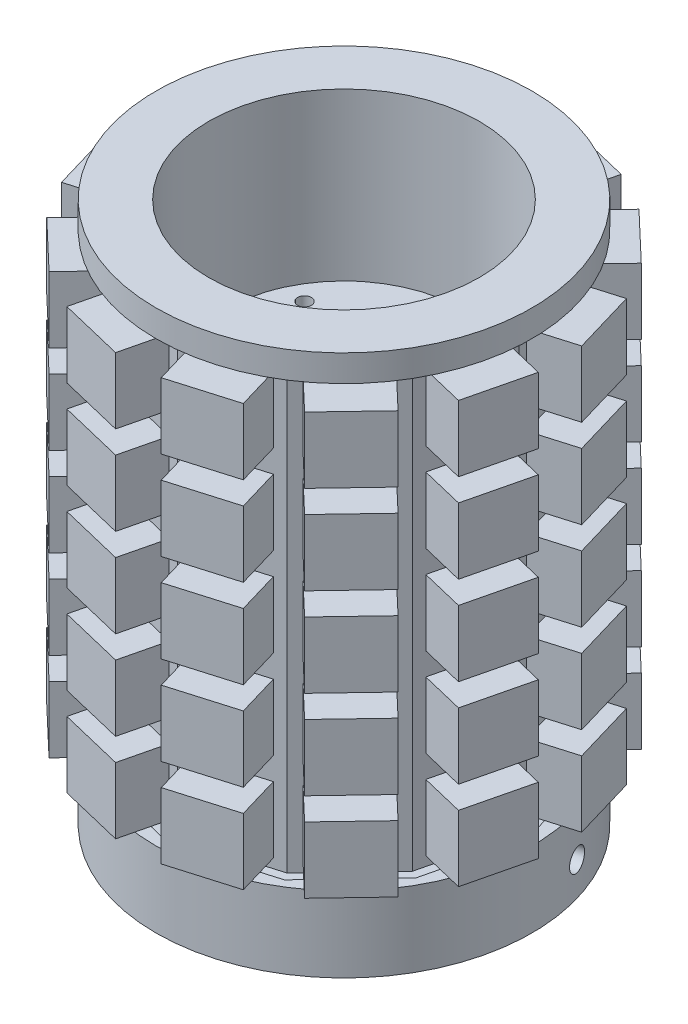
from build123d import *

# Parameters (mm, degrees)
EXTRUDE_THIN2_DEPTH        = 100
SKETCH4_W                  = 14.9
SKETCH4_H                  = 14.9
BOSS_EXTRUDE1_DEPTH        = 10
CIRPATTERN1_COUNT          = 12
LPATTERN1_COUNT            = 5
LPATTERN1_PITCH            = 20
LPATTERN1_COPY_1_SKETCH_W  = 14.9
LPATTERN1_COPY_1_SKETCH_H  = 14.9
LPATTERN1_COPY_1_DEPTH     = 10
LPATTERN1_COPY_2_SKETCH_W  = 14.9
LPATTERN1_COPY_2_SKETCH_H  = 14.9
LPATTERN1_COPY_2_DEPTH     = 10
LPATTERN1_COPY_3_SKETCH_W  = 14.9
LPATTERN1_COPY_3_SKETCH_H  = 14.9
LPATTERN1_COPY_3_DEPTH     = 10
LPATTERN1_COPY_4_SKETCH_W  = 14.9
LPATTERN1_COPY_4_SKETCH_H  = 14.9
LPATTERN1_COPY_4_DEPTH     = 10
LPATTERN1_COPY_5_SKETCH_W  = 14.9
LPATTERN1_COPY_5_SKETCH_H  = 14.9
LPATTERN1_COPY_5_DEPTH     = 10
LPATTERN1_COPY_6_SKETCH_W  = 14.9
LPATTERN1_COPY_6_SKETCH_H  = 14.9
LPATTERN1_COPY_6_DEPTH     = 10
LPATTERN1_COPY_7_SKETCH_W  = 14.9
LPATTERN1_COPY_7_SKETCH_H  = 14.9
LPATTERN1_COPY_7_DEPTH     = 10
LPATTERN1_COPY_8_SKETCH_W  = 14.9
LPATTERN1_COPY_8_SKETCH_H  = 14.9
LPATTERN1_COPY_8_DEPTH     = 10
LPATTERN1_COPY_9_SKETCH_W  = 14.9
LPATTERN1_COPY_9_SKETCH_H  = 14.9
LPATTERN1_COPY_9_DEPTH     = 10
LPATTERN1_COPY_10_SKETCH_W = 14.9
LPATTERN1_COPY_10_SKETCH_H = 14.9
LPATTERN1_COPY_10_DEPTH    = 10
LPATTERN1_COPY_11_SKETCH_W = 14.9
LPATTERN1_COPY_11_SKETCH_H = 14.9
LPATTERN1_COPY_11_DEPTH    = 10
LPATTERN1_COPY_12_SKETCH_W = 14.9
LPATTERN1_COPY_12_SKETCH_H = 14.9
LPATTERN1_COPY_12_DEPTH    = 10
LPATTERN1_COPY_13_SKETCH_W = 14.9
LPATTERN1_COPY_13_SKETCH_H = 14.9
LPATTERN1_COPY_13_DEPTH    = 10
LPATTERN1_COPY_14_SKETCH_W = 14.9
LPATTERN1_COPY_14_SKETCH_H = 14.9
LPATTERN1_COPY_14_DEPTH    = 10
LPATTERN1_COPY_15_SKETCH_W = 14.9
LPATTERN1_COPY_15_SKETCH_H = 14.9
LPATTERN1_COPY_15_DEPTH    = 10
LPATTERN1_COPY_16_SKETCH_W = 14.9
LPATTERN1_COPY_16_SKETCH_H = 14.9
LPATTERN1_COPY_16_DEPTH    = 10
LPATTERN1_COPY_17_SKETCH_W = 14.9
LPATTERN1_COPY_17_SKETCH_H = 14.9
LPATTERN1_COPY_17_DEPTH    = 10
LPATTERN1_COPY_18_SKETCH_W = 14.9
LPATTERN1_COPY_18_SKETCH_H = 14.9
LPATTERN1_COPY_18_DEPTH    = 10
LPATTERN1_COPY_19_SKETCH_W = 14.9
LPATTERN1_COPY_19_SKETCH_H = 14.9
LPATTERN1_COPY_19_DEPTH    = 10
LPATTERN1_COPY_20_SKETCH_W = 14.9
LPATTERN1_COPY_20_SKETCH_H = 14.9
LPATTERN1_COPY_20_DEPTH    = 10
LPATTERN1_COPY_21_SKETCH_W = 14.9
LPATTERN1_COPY_21_SKETCH_H = 14.9
LPATTERN1_COPY_21_DEPTH    = 10
LPATTERN1_COPY_22_SKETCH_W = 14.9
LPATTERN1_COPY_22_SKETCH_H = 14.9
LPATTERN1_COPY_22_DEPTH    = 10
LPATTERN1_COPY_23_SKETCH_W = 14.9
LPATTERN1_COPY_23_SKETCH_H = 14.9
LPATTERN1_COPY_23_DEPTH    = 10
LPATTERN1_COPY_24_SKETCH_W = 14.9
LPATTERN1_COPY_24_SKETCH_H = 14.9
LPATTERN1_COPY_24_DEPTH    = 10
LPATTERN1_COPY_25_SKETCH_W = 14.9
LPATTERN1_COPY_25_SKETCH_H = 14.9
LPATTERN1_COPY_25_DEPTH    = 10
LPATTERN1_COPY_26_SKETCH_W = 14.9
LPATTERN1_COPY_26_SKETCH_H = 14.9
LPATTERN1_COPY_26_DEPTH    = 10
LPATTERN1_COPY_27_SKETCH_W = 14.9
LPATTERN1_COPY_27_SKETCH_H = 14.9
LPATTERN1_COPY_27_DEPTH    = 10
LPATTERN1_COPY_28_SKETCH_W = 14.9
LPATTERN1_COPY_28_SKETCH_H = 14.9
LPATTERN1_COPY_28_DEPTH    = 10
LPATTERN1_COPY_29_SKETCH_W = 14.9
LPATTERN1_COPY_29_SKETCH_H = 14.9
LPATTERN1_COPY_29_DEPTH    = 10
LPATTERN1_COPY_30_SKETCH_W = 14.9
LPATTERN1_COPY_30_SKETCH_H = 14.9
LPATTERN1_COPY_30_DEPTH    = 10
LPATTERN1_COPY_31_SKETCH_W = 14.9
LPATTERN1_COPY_31_SKETCH_H = 14.9
LPATTERN1_COPY_31_DEPTH    = 10
LPATTERN1_COPY_32_SKETCH_W = 14.9
LPATTERN1_COPY_32_SKETCH_H = 14.9
LPATTERN1_COPY_32_DEPTH    = 10
LPATTERN1_COPY_33_SKETCH_W = 14.9
LPATTERN1_COPY_33_SKETCH_H = 14.9
LPATTERN1_COPY_33_DEPTH    = 10
LPATTERN1_COPY_34_SKETCH_W = 14.9
LPATTERN1_COPY_34_SKETCH_H = 14.9
LPATTERN1_COPY_34_DEPTH    = 10
LPATTERN1_COPY_35_SKETCH_W = 14.9
LPATTERN1_COPY_35_SKETCH_H = 14.9
LPATTERN1_COPY_35_DEPTH    = 10
LPATTERN1_COPY_36_SKETCH_W = 14.9
LPATTERN1_COPY_36_SKETCH_H = 14.9
LPATTERN1_COPY_36_DEPTH    = 10
LPATTERN1_COPY_37_SKETCH_W = 14.9
LPATTERN1_COPY_37_SKETCH_H = 14.9
LPATTERN1_COPY_37_DEPTH    = 10
LPATTERN1_COPY_38_SKETCH_W = 14.9
LPATTERN1_COPY_38_SKETCH_H = 14.9
LPATTERN1_COPY_38_DEPTH    = 10
LPATTERN1_COPY_39_SKETCH_W = 14.9
LPATTERN1_COPY_39_SKETCH_H = 14.9
LPATTERN1_COPY_39_DEPTH    = 10
LPATTERN1_COPY_40_SKETCH_W = 14.9
LPATTERN1_COPY_40_SKETCH_H = 14.9
LPATTERN1_COPY_40_DEPTH    = 10
LPATTERN1_COPY_41_SKETCH_W = 14.9
LPATTERN1_COPY_41_SKETCH_H = 14.9
LPATTERN1_COPY_41_DEPTH    = 10
LPATTERN1_COPY_42_SKETCH_W = 14.9
LPATTERN1_COPY_42_SKETCH_H = 14.9
LPATTERN1_COPY_42_DEPTH    = 10
LPATTERN1_COPY_43_SKETCH_W = 14.9
LPATTERN1_COPY_43_SKETCH_H = 14.9
LPATTERN1_COPY_43_DEPTH    = 10
LPATTERN1_COPY_44_SKETCH_W = 14.9
LPATTERN1_COPY_44_SKETCH_H = 14.9
LPATTERN1_COPY_44_DEPTH    = 10
SKETCH6_R                  = 42.363501302
BOSS_EXTRUDE2_DEPTH        = 12
SKETCH7_R                  = 42.363501302
BOSS_EXTRUDE3_DEPTH        = 5
SKETCH8_R                  = 2.5
CUT_EXTRUDE1_DEPTH         = 10
BOSS_EXTRUDE4_DEPTH        = 3
BOSS_EXTRUDE4_DEPTH_BACK   = 1
SKETCH10_R                 = 42.363501302
SKETCH11_R                 = 42.363501302
BOSS_EXTRUDE5_DEPTH        = 2
SKETCH12_R                 = 32.5
SKETCH12_R_2               = 30.5
BOSS_EXTRUDE6_DEPTH        = 95
SKETCH13_R                 = 30.5
CUT_EXTRUDE3_DEPTH         = 95
SKETCH14_R                 = 32.5
BOSS_EXTRUDE7_DEPTH        = 2
SKETCH9_R                  = 1.55
CUT_EXTRUDE2_DEPTH         = 138
SKETCH15_R                 = 2.85
CUT_EXTRUDE4_DEPTH         = 3.2


with BuildPart() as part:
    # Loft1: read off the stored shape, not the designer's step
    # Loft1: loft between two sections, ruled curve by curve
    loft1_from = [
        Edge.make_bspline([(17.67910354, 0, 31.359995185), (80.399093911, 0, -3.998211894), (45.040886831, 0, -66.718202265), (-17.67910354, 0, -31.359995185), (-80.399093911, 0, 3.998211894), (-45.040886831, 0, 66.718202265), (17.67910354, 0, 31.359995185)], [0, 0, 0, 0, 0.5, 0.5, 0.5, 1, 1, 1, 1], 3, [1, 0.333333333, 0.333333333, 1, 0.333333333, 0.333333333, 1]),
    ]
    loft1_to = [
        Edge.make_bspline([(22.196815987, 70, 15.3720968), (52.941009587, 70, -29.021535174), (8.547377613, 70, -59.765728774), (-22.196815987, 70, -15.3720968), (-52.941009587, 70, 29.021535174), (-8.547377613, 70, 59.765728774), (22.196815987, 70, 15.3720968)], [0, 0, 0, 0, 0.5, 0.5, 0.5, 1, 1, 1, 1], 3, [1, 0.333333333, 0.333333333, 1, 0.333333333, 0.333333333, 1]),
    ]
    loft1 = Solid(Shell([*[Face.make_surface_from_curves(loft1_from[k], loft1_to[k]) for k in range(1)], Face(Wire(loft1_from)), Face(Wire(loft1_to))]))
    add(loft1)


with BuildPart() as body_2:
    # Sketch3 → Extrude-Thin2 (new body)
    with BuildSketch(Plane(origin=(0, 0, 0), x_dir=(-1, 0, 0), z_dir=(0, -1, 0))):
        Polygon((-18.425658339, 33.818491341), (-32.866333873, 20.07484345), (-38.500501789, 0.952157468), (-33.818491341, -18.425658339), (-20.07484345, -32.866333873), (-0.952157468, -38.500501789), (18.425658339, -33.818491341), (32.866333873, -20.07484345), (38.500501789, -0.952157468), (33.818491341, 18.425658339), (20.07484345, 32.866333873), (0.952157468, 38.500501789), align=None)
        Polygon((-17.831282263, 32.727572266), (-31.806129555, 19.427267855), (-37.258550118, 0.921442711), (-32.727572266, -17.831282263), (-19.427267855, -31.806129555), (-0.921442711, -37.258550118), (17.831282263, -32.727572266), (31.806129555, -19.427267855), (37.258550118, -0.921442711), (32.727572266, 17.831282263), (19.427267855, 31.806129555), (0.921442711, 37.258550118), align=None, mode=Mode.SUBTRACT)
    extrude(amount=-EXTRUDE_THIN2_DEPTH)

    # Sketch4 → Boss-Extrude1 (add)
    with BuildSketch(Plane(origin=(-10.513500459, 0, -35.683417831), x_dir=(-0.959231662124633, 0, 0.2826209800733382), z_dir=(-0.2826209800733382, 0, -0.959231662124633))):
        with Locations((0, 89.55)):
            Rectangle(SKETCH4_W, SKETCH4_H)
    boss_extrude1 = extrude(amount=BOSS_EXTRUDE1_DEPTH)

    # CirPattern1: Boss-Extrude1 ×12 about axis
    cirpattern1_axis = Axis((0, 0, 0), (0, 1, 0))
    for i in range(1, CIRPATTERN1_COUNT):
        add(boss_extrude1.rotate(cirpattern1_axis, i * 360 / CIRPATTERN1_COUNT))

    # LPattern1: Boss-Extrude1 ×5
    with Locations(*[(0, -i * LPATTERN1_PITCH, 0) for i in range(1, LPATTERN1_COUNT)]):
        add(boss_extrude1)

    # LPattern1 copy 1 sketch → LPattern1 copy 1 (add)
    with BuildSketch(Plane(origin=(-26.946667395, -20, -25.645996106), x_dir=(-0.6894084974776344, 0, 0.7243727794482829), z_dir=(-0.7243727794482829, 0, -0.6894084974776344))):
        with Locations((0, 89.55)):
            Rectangle(LPATTERN1_COPY_1_SKETCH_W, LPATTERN1_COPY_1_SKETCH_H)
    extrude(amount=LPATTERN1_COPY_1_DEPTH)

    # LPattern1 copy 2 sketch → LPattern1 copy 2 (add)
    with BuildSketch(Plane(origin=(-26.946667395, -40, -25.645996106), x_dir=(-0.6894084974776344, 0, 0.7243727794482829), z_dir=(-0.7243727794482829, 0, -0.6894084974776344))):
        with Locations((0, 89.55)):
            Rectangle(LPATTERN1_COPY_2_SKETCH_W, LPATTERN1_COPY_2_SKETCH_H)
    extrude(amount=LPATTERN1_COPY_2_DEPTH)

    # LPattern1 copy 3 sketch → LPattern1 copy 3 (add)
    with BuildSketch(Plane(origin=(-26.946667395, -60, -25.645996106), x_dir=(-0.6894084974776344, 0, 0.7243727794482829), z_dir=(-0.7243727794482829, 0, -0.6894084974776344))):
        with Locations((0, 89.55)):
            Rectangle(LPATTERN1_COPY_3_SKETCH_W, LPATTERN1_COPY_3_SKETCH_H)
    extrude(amount=LPATTERN1_COPY_3_DEPTH)

    # LPattern1 copy 4 sketch → LPattern1 copy 4 (add)
    with BuildSketch(Plane(origin=(-26.946667395, -80, -25.645996106), x_dir=(-0.6894084974776344, 0, 0.7243727794482829), z_dir=(-0.7243727794482829, 0, -0.6894084974776344))):
        with Locations((0, 89.55)):
            Rectangle(LPATTERN1_COPY_4_SKETCH_W, LPATTERN1_COPY_4_SKETCH_H)
    extrude(amount=LPATTERN1_COPY_4_DEPTH)

    # LPattern1 copy 5 sketch → LPattern1 copy 5 (add)
    with BuildSketch(Plane(origin=(-36.159496565, -20, -8.736750436), x_dir=(-0.2348588826763501, 0, 0.9720294775509726), z_dir=(-0.9720294775509726, 0, -0.2348588826763501))):
        with Locations((0, 89.55)):
            Rectangle(LPATTERN1_COPY_5_SKETCH_W, LPATTERN1_COPY_5_SKETCH_H)
    extrude(amount=LPATTERN1_COPY_5_DEPTH)

    # LPattern1 copy 6 sketch → LPattern1 copy 6 (add)
    with BuildSketch(Plane(origin=(-36.159496565, -40, -8.736750436), x_dir=(-0.2348588826763501, 0, 0.9720294775509726), z_dir=(-0.9720294775509726, 0, -0.2348588826763501))):
        with Locations((0, 89.55)):
            Rectangle(LPATTERN1_COPY_6_SKETCH_W, LPATTERN1_COPY_6_SKETCH_H)
    extrude(amount=LPATTERN1_COPY_6_DEPTH)

    # LPattern1 copy 7 sketch → LPattern1 copy 7 (add)
    with BuildSketch(Plane(origin=(-36.159496565, -60, -8.736750436), x_dir=(-0.2348588826763501, 0, 0.9720294775509726), z_dir=(-0.9720294775509726, 0, -0.2348588826763501))):
        with Locations((0, 89.55)):
            Rectangle(LPATTERN1_COPY_7_SKETCH_W, LPATTERN1_COPY_7_SKETCH_H)
    extrude(amount=LPATTERN1_COPY_7_DEPTH)

    # LPattern1 copy 8 sketch → LPattern1 copy 8 (add)
    with BuildSketch(Plane(origin=(-36.159496565, -80, -8.736750436), x_dir=(-0.2348588826763501, 0, 0.9720294775509726), z_dir=(-0.9720294775509726, 0, -0.2348588826763501))):
        with Locations((0, 89.55)):
            Rectangle(LPATTERN1_COPY_8_SKETCH_W, LPATTERN1_COPY_8_SKETCH_H)
    extrude(amount=LPATTERN1_COPY_8_DEPTH)

    # LPattern1 copy 9 sketch → LPattern1 copy 9 (add)
    with BuildSketch(Plane(origin=(-35.683417831, -20, 10.513500459), x_dir=(0.28262098007333813, 0, 0.959231662124633), z_dir=(-0.959231662124633, 0, 0.28262098007333813))):
        with Locations((0, 89.55)):
            Rectangle(LPATTERN1_COPY_9_SKETCH_W, LPATTERN1_COPY_9_SKETCH_H)
    extrude(amount=LPATTERN1_COPY_9_DEPTH)

    # LPattern1 copy 10 sketch → LPattern1 copy 10 (add)
    with BuildSketch(Plane(origin=(-35.683417831, -40, 10.513500459), x_dir=(0.28262098007333813, 0, 0.959231662124633), z_dir=(-0.959231662124633, 0, 0.28262098007333813))):
        with Locations((0, 89.55)):
            Rectangle(LPATTERN1_COPY_10_SKETCH_W, LPATTERN1_COPY_10_SKETCH_H)
    extrude(amount=LPATTERN1_COPY_10_DEPTH)

    # LPattern1 copy 11 sketch → LPattern1 copy 11 (add)
    with BuildSketch(Plane(origin=(-35.683417831, -60, 10.513500459), x_dir=(0.28262098007333813, 0, 0.959231662124633), z_dir=(-0.959231662124633, 0, 0.28262098007333813))):
        with Locations((0, 89.55)):
            Rectangle(LPATTERN1_COPY_11_SKETCH_W, LPATTERN1_COPY_11_SKETCH_H)
    extrude(amount=LPATTERN1_COPY_11_DEPTH)

    # LPattern1 copy 12 sketch → LPattern1 copy 12 (add)
    with BuildSketch(Plane(origin=(-35.683417831, -80, 10.513500459), x_dir=(0.28262098007333813, 0, 0.959231662124633), z_dir=(-0.959231662124633, 0, 0.28262098007333813))):
        with Locations((0, 89.55)):
            Rectangle(LPATTERN1_COPY_12_SKETCH_W, LPATTERN1_COPY_12_SKETCH_H)
    extrude(amount=LPATTERN1_COPY_12_DEPTH)

    # LPattern1 copy 13 sketch → LPattern1 copy 13 (add)
    with BuildSketch(Plane(origin=(-25.645996106, -20, 26.946667395), x_dir=(0.7243727794482828, 0, 0.6894084974776344), z_dir=(-0.6894084974776344, 0, 0.7243727794482828))):
        with Locations((0, 89.55)):
            Rectangle(LPATTERN1_COPY_13_SKETCH_W, LPATTERN1_COPY_13_SKETCH_H)
    extrude(amount=LPATTERN1_COPY_13_DEPTH)

    # LPattern1 copy 14 sketch → LPattern1 copy 14 (add)
    with BuildSketch(Plane(origin=(-25.645996106, -40, 26.946667395), x_dir=(0.7243727794482828, 0, 0.6894084974776344), z_dir=(-0.6894084974776344, 0, 0.7243727794482828))):
        with Locations((0, 89.55)):
            Rectangle(LPATTERN1_COPY_14_SKETCH_W, LPATTERN1_COPY_14_SKETCH_H)
    extrude(amount=LPATTERN1_COPY_14_DEPTH)

    # LPattern1 copy 15 sketch → LPattern1 copy 15 (add)
    with BuildSketch(Plane(origin=(-25.645996106, -60, 26.946667395), x_dir=(0.7243727794482828, 0, 0.6894084974776344), z_dir=(-0.6894084974776344, 0, 0.7243727794482828))):
        with Locations((0, 89.55)):
            Rectangle(LPATTERN1_COPY_15_SKETCH_W, LPATTERN1_COPY_15_SKETCH_H)
    extrude(amount=LPATTERN1_COPY_15_DEPTH)

    # LPattern1 copy 16 sketch → LPattern1 copy 16 (add)
    with BuildSketch(Plane(origin=(-25.645996106, -80, 26.946667395), x_dir=(0.7243727794482828, 0, 0.6894084974776344), z_dir=(-0.6894084974776344, 0, 0.7243727794482828))):
        with Locations((0, 89.55)):
            Rectangle(LPATTERN1_COPY_16_SKETCH_W, LPATTERN1_COPY_16_SKETCH_H)
    extrude(amount=LPATTERN1_COPY_16_DEPTH)

    # LPattern1 copy 17 sketch → LPattern1 copy 17 (add)
    with BuildSketch(Plane(origin=(-8.736750436, -20, 36.159496565), x_dir=(0.9720294775509726, 0, 0.2348588826763499), z_dir=(-0.2348588826763499, 0, 0.9720294775509726))):
        with Locations((0, 89.55)):
            Rectangle(LPATTERN1_COPY_17_SKETCH_W, LPATTERN1_COPY_17_SKETCH_H)
    extrude(amount=LPATTERN1_COPY_17_DEPTH)

    # LPattern1 copy 18 sketch → LPattern1 copy 18 (add)
    with BuildSketch(Plane(origin=(-8.736750436, -40, 36.159496565), x_dir=(0.9720294775509726, 0, 0.2348588826763499), z_dir=(-0.2348588826763499, 0, 0.9720294775509726))):
        with Locations((0, 89.55)):
            Rectangle(LPATTERN1_COPY_18_SKETCH_W, LPATTERN1_COPY_18_SKETCH_H)
    extrude(amount=LPATTERN1_COPY_18_DEPTH)

    # LPattern1 copy 19 sketch → LPattern1 copy 19 (add)
    with BuildSketch(Plane(origin=(-8.736750436, -60, 36.159496565), x_dir=(0.9720294775509726, 0, 0.2348588826763499), z_dir=(-0.2348588826763499, 0, 0.9720294775509726))):
        with Locations((0, 89.55)):
            Rectangle(LPATTERN1_COPY_19_SKETCH_W, LPATTERN1_COPY_19_SKETCH_H)
    extrude(amount=LPATTERN1_COPY_19_DEPTH)

    # LPattern1 copy 20 sketch → LPattern1 copy 20 (add)
    with BuildSketch(Plane(origin=(-8.736750436, -80, 36.159496565), x_dir=(0.9720294775509726, 0, 0.2348588826763499), z_dir=(-0.2348588826763499, 0, 0.9720294775509726))):
        with Locations((0, 89.55)):
            Rectangle(LPATTERN1_COPY_20_SKETCH_W, LPATTERN1_COPY_20_SKETCH_H)
    extrude(amount=LPATTERN1_COPY_20_DEPTH)

    # LPattern1 copy 21 sketch → LPattern1 copy 21 (add)
    with BuildSketch(Plane(origin=(10.513500459, -20, 35.683417831), x_dir=(0.959231662124633, 0, -0.2826209800733381), z_dir=(0.2826209800733381, 0, 0.959231662124633))):
        with Locations((0, 89.55)):
            Rectangle(LPATTERN1_COPY_21_SKETCH_W, LPATTERN1_COPY_21_SKETCH_H)
    extrude(amount=LPATTERN1_COPY_21_DEPTH)

    # LPattern1 copy 22 sketch → LPattern1 copy 22 (add)
    with BuildSketch(Plane(origin=(10.513500459, -40, 35.683417831), x_dir=(0.959231662124633, 0, -0.2826209800733381), z_dir=(0.2826209800733381, 0, 0.959231662124633))):
        with Locations((0, 89.55)):
            Rectangle(LPATTERN1_COPY_22_SKETCH_W, LPATTERN1_COPY_22_SKETCH_H)
    extrude(amount=LPATTERN1_COPY_22_DEPTH)

    # LPattern1 copy 23 sketch → LPattern1 copy 23 (add)
    with BuildSketch(Plane(origin=(10.513500459, -60, 35.683417831), x_dir=(0.959231662124633, 0, -0.2826209800733381), z_dir=(0.2826209800733381, 0, 0.959231662124633))):
        with Locations((0, 89.55)):
            Rectangle(LPATTERN1_COPY_23_SKETCH_W, LPATTERN1_COPY_23_SKETCH_H)
    extrude(amount=LPATTERN1_COPY_23_DEPTH)

    # LPattern1 copy 24 sketch → LPattern1 copy 24 (add)
    with BuildSketch(Plane(origin=(10.513500459, -80, 35.683417831), x_dir=(0.959231662124633, 0, -0.2826209800733381), z_dir=(0.2826209800733381, 0, 0.959231662124633))):
        with Locations((0, 89.55)):
            Rectangle(LPATTERN1_COPY_24_SKETCH_W, LPATTERN1_COPY_24_SKETCH_H)
    extrude(amount=LPATTERN1_COPY_24_DEPTH)

    # LPattern1 copy 25 sketch → LPattern1 copy 25 (add)
    with BuildSketch(Plane(origin=(26.946667395, -20, 25.645996106), x_dir=(0.6894084974776342, 0, -0.724372779448283), z_dir=(0.724372779448283, 0, 0.6894084974776342))):
        with Locations((0, 89.55)):
            Rectangle(LPATTERN1_COPY_25_SKETCH_W, LPATTERN1_COPY_25_SKETCH_H)
    extrude(amount=LPATTERN1_COPY_25_DEPTH)

    # LPattern1 copy 26 sketch → LPattern1 copy 26 (add)
    with BuildSketch(Plane(origin=(26.946667395, -40, 25.645996106), x_dir=(0.6894084974776342, 0, -0.724372779448283), z_dir=(0.724372779448283, 0, 0.6894084974776342))):
        with Locations((0, 89.55)):
            Rectangle(LPATTERN1_COPY_26_SKETCH_W, LPATTERN1_COPY_26_SKETCH_H)
    extrude(amount=LPATTERN1_COPY_26_DEPTH)

    # LPattern1 copy 27 sketch → LPattern1 copy 27 (add)
    with BuildSketch(Plane(origin=(26.946667395, -60, 25.645996106), x_dir=(0.6894084974776342, 0, -0.724372779448283), z_dir=(0.724372779448283, 0, 0.6894084974776342))):
        with Locations((0, 89.55)):
            Rectangle(LPATTERN1_COPY_27_SKETCH_W, LPATTERN1_COPY_27_SKETCH_H)
    extrude(amount=LPATTERN1_COPY_27_DEPTH)

    # LPattern1 copy 28 sketch → LPattern1 copy 28 (add)
    with BuildSketch(Plane(origin=(26.946667395, -80, 25.645996106), x_dir=(0.6894084974776342, 0, -0.724372779448283), z_dir=(0.724372779448283, 0, 0.6894084974776342))):
        with Locations((0, 89.55)):
            Rectangle(LPATTERN1_COPY_28_SKETCH_W, LPATTERN1_COPY_28_SKETCH_H)
    extrude(amount=LPATTERN1_COPY_28_DEPTH)

    # LPattern1 copy 29 sketch → LPattern1 copy 29 (add)
    with BuildSketch(Plane(origin=(36.159496565, -20, 8.736750436), x_dir=(0.2348588826763505, 0, -0.9720294775509724), z_dir=(0.9720294775509724, 0, 0.2348588826763505))):
        with Locations((0, 89.55)):
            Rectangle(LPATTERN1_COPY_29_SKETCH_W, LPATTERN1_COPY_29_SKETCH_H)
    extrude(amount=LPATTERN1_COPY_29_DEPTH)

    # LPattern1 copy 30 sketch → LPattern1 copy 30 (add)
    with BuildSketch(Plane(origin=(36.159496565, -40, 8.736750436), x_dir=(0.2348588826763505, 0, -0.9720294775509724), z_dir=(0.9720294775509724, 0, 0.2348588826763505))):
        with Locations((0, 89.55)):
            Rectangle(LPATTERN1_COPY_30_SKETCH_W, LPATTERN1_COPY_30_SKETCH_H)
    extrude(amount=LPATTERN1_COPY_30_DEPTH)

    # LPattern1 copy 31 sketch → LPattern1 copy 31 (add)
    with BuildSketch(Plane(origin=(36.159496565, -60, 8.736750436), x_dir=(0.2348588826763505, 0, -0.9720294775509724), z_dir=(0.9720294775509724, 0, 0.2348588826763505))):
        with Locations((0, 89.55)):
            Rectangle(LPATTERN1_COPY_31_SKETCH_W, LPATTERN1_COPY_31_SKETCH_H)
    extrude(amount=LPATTERN1_COPY_31_DEPTH)

    # LPattern1 copy 32 sketch → LPattern1 copy 32 (add)
    with BuildSketch(Plane(origin=(36.159496565, -80, 8.736750436), x_dir=(0.2348588826763505, 0, -0.9720294775509724), z_dir=(0.9720294775509724, 0, 0.2348588826763505))):
        with Locations((0, 89.55)):
            Rectangle(LPATTERN1_COPY_32_SKETCH_W, LPATTERN1_COPY_32_SKETCH_H)
    extrude(amount=LPATTERN1_COPY_32_DEPTH)

    # LPattern1 copy 33 sketch → LPattern1 copy 33 (add)
    with BuildSketch(Plane(origin=(35.683417831, -20, -10.513500459), x_dir=(-0.282620980073338, 0, -0.959231662124633), z_dir=(0.959231662124633, 0, -0.282620980073338))):
        with Locations((0, 89.55)):
            Rectangle(LPATTERN1_COPY_33_SKETCH_W, LPATTERN1_COPY_33_SKETCH_H)
    extrude(amount=LPATTERN1_COPY_33_DEPTH)

    # LPattern1 copy 34 sketch → LPattern1 copy 34 (add)
    with BuildSketch(Plane(origin=(35.683417831, -40, -10.513500459), x_dir=(-0.282620980073338, 0, -0.959231662124633), z_dir=(0.959231662124633, 0, -0.282620980073338))):
        with Locations((0, 89.55)):
            Rectangle(LPATTERN1_COPY_34_SKETCH_W, LPATTERN1_COPY_34_SKETCH_H)
    extrude(amount=LPATTERN1_COPY_34_DEPTH)

    # LPattern1 copy 35 sketch → LPattern1 copy 35 (add)
    with BuildSketch(Plane(origin=(35.683417831, -60, -10.513500459), x_dir=(-0.282620980073338, 0, -0.959231662124633), z_dir=(0.959231662124633, 0, -0.282620980073338))):
        with Locations((0, 89.55)):
            Rectangle(LPATTERN1_COPY_35_SKETCH_W, LPATTERN1_COPY_35_SKETCH_H)
    extrude(amount=LPATTERN1_COPY_35_DEPTH)

    # LPattern1 copy 36 sketch → LPattern1 copy 36 (add)
    with BuildSketch(Plane(origin=(35.683417831, -80, -10.513500459), x_dir=(-0.282620980073338, 0, -0.959231662124633), z_dir=(0.959231662124633, 0, -0.282620980073338))):
        with Locations((0, 89.55)):
            Rectangle(LPATTERN1_COPY_36_SKETCH_W, LPATTERN1_COPY_36_SKETCH_H)
    extrude(amount=LPATTERN1_COPY_36_DEPTH)

    # LPattern1 copy 37 sketch → LPattern1 copy 37 (add)
    with BuildSketch(Plane(origin=(25.645996106, -20, -26.946667395), x_dir=(-0.724372779448283, 0, -0.6894084974776342), z_dir=(0.6894084974776342, 0, -0.724372779448283))):
        with Locations((0, 89.55)):
            Rectangle(LPATTERN1_COPY_37_SKETCH_W, LPATTERN1_COPY_37_SKETCH_H)
    extrude(amount=LPATTERN1_COPY_37_DEPTH)

    # LPattern1 copy 38 sketch → LPattern1 copy 38 (add)
    with BuildSketch(Plane(origin=(25.645996106, -40, -26.946667395), x_dir=(-0.724372779448283, 0, -0.6894084974776342), z_dir=(0.6894084974776342, 0, -0.724372779448283))):
        with Locations((0, 89.55)):
            Rectangle(LPATTERN1_COPY_38_SKETCH_W, LPATTERN1_COPY_38_SKETCH_H)
    extrude(amount=LPATTERN1_COPY_38_DEPTH)

    # LPattern1 copy 39 sketch → LPattern1 copy 39 (add)
    with BuildSketch(Plane(origin=(25.645996106, -60, -26.946667395), x_dir=(-0.724372779448283, 0, -0.6894084974776342), z_dir=(0.6894084974776342, 0, -0.724372779448283))):
        with Locations((0, 89.55)):
            Rectangle(LPATTERN1_COPY_39_SKETCH_W, LPATTERN1_COPY_39_SKETCH_H)
    extrude(amount=LPATTERN1_COPY_39_DEPTH)

    # LPattern1 copy 40 sketch → LPattern1 copy 40 (add)
    with BuildSketch(Plane(origin=(25.645996106, -80, -26.946667395), x_dir=(-0.724372779448283, 0, -0.6894084974776342), z_dir=(0.6894084974776342, 0, -0.724372779448283))):
        with Locations((0, 89.55)):
            Rectangle(LPATTERN1_COPY_40_SKETCH_W, LPATTERN1_COPY_40_SKETCH_H)
    extrude(amount=LPATTERN1_COPY_40_DEPTH)

    # LPattern1 copy 41 sketch → LPattern1 copy 41 (add)
    with BuildSketch(Plane(origin=(8.736750436, -20, -36.159496565), x_dir=(-0.9720294775509724, 0, -0.2348588826763505), z_dir=(0.2348588826763505, 0, -0.9720294775509724))):
        with Locations((0, 89.55)):
            Rectangle(LPATTERN1_COPY_41_SKETCH_W, LPATTERN1_COPY_41_SKETCH_H)
    extrude(amount=LPATTERN1_COPY_41_DEPTH)

    # LPattern1 copy 42 sketch → LPattern1 copy 42 (add)
    with BuildSketch(Plane(origin=(8.736750436, -40, -36.159496565), x_dir=(-0.9720294775509724, 0, -0.2348588826763505), z_dir=(0.2348588826763505, 0, -0.9720294775509724))):
        with Locations((0, 89.55)):
            Rectangle(LPATTERN1_COPY_42_SKETCH_W, LPATTERN1_COPY_42_SKETCH_H)
    extrude(amount=LPATTERN1_COPY_42_DEPTH)

    # LPattern1 copy 43 sketch → LPattern1 copy 43 (add)
    with BuildSketch(Plane(origin=(8.736750436, -60, -36.159496565), x_dir=(-0.9720294775509724, 0, -0.2348588826763505), z_dir=(0.2348588826763505, 0, -0.9720294775509724))):
        with Locations((0, 89.55)):
            Rectangle(LPATTERN1_COPY_43_SKETCH_W, LPATTERN1_COPY_43_SKETCH_H)
    extrude(amount=LPATTERN1_COPY_43_DEPTH)

    # LPattern1 copy 44 sketch → LPattern1 copy 44 (add)
    with BuildSketch(Plane(origin=(8.736750436, -80, -36.159496565), x_dir=(-0.9720294775509724, 0, -0.2348588826763505), z_dir=(0.2348588826763505, 0, -0.9720294775509724))):
        with Locations((0, 89.55)):
            Rectangle(LPATTERN1_COPY_44_SKETCH_W, LPATTERN1_COPY_44_SKETCH_H)
    extrude(amount=LPATTERN1_COPY_44_DEPTH)


with BuildPart() as body_3:
    # Sketch6 → Boss-Extrude2 (new body)
    with BuildSketch(Plane.XZ):
        with Locations(Location((0, 0, 0), (0, 0, 270))):
            Circle(SKETCH6_R)
        Polygon((-40.425526878, 0.999765341), (-35.509415908, -19.346941256), (-21.078585622, -34.509650567), (-0.999765341, -40.425526878), (19.346941256, -35.509415908), (34.509650567, -21.078585622), (40.425526878, -0.999765341), (35.509415908, 19.346941256), (21.078585622, 34.509650567), (0.999765341, 40.425526878), (-19.346941256, 35.509415908), (-34.509650567, 21.078585622), align=None, mode=Mode.SUBTRACT)
    extrude(amount=BOSS_EXTRUDE2_DEPTH)

    # Sketch7 → Boss-Extrude3 (add)
    with BuildSketch(Plane(origin=(0, -12, 0), x_dir=(-1, 0, 0), z_dir=(0, -1, 0))):
        with Locations(Location((0, 0, 0), (0, 0, 90))):
            Circle(SKETCH7_R)
    extrude(amount=BOSS_EXTRUDE3_DEPTH)

    # Sketch8 → Cut-Extrude1 (cut)
    with BuildSketch(Plane(origin=(37.467588723, 0, -11.039175482), x_dir=(0.2826209800733386, 0, 0.9592316621246327), z_dir=(-0.9592316621246327, 0, 0.2826209800733386))):
        with Locations((0, -9.5)):
            Circle(SKETCH8_R)
    extrude(amount=-CUT_EXTRUDE1_DEPTH, mode=Mode.SUBTRACT)


with BuildPart() as body_4:
    # Sketch10 → Boss-Extrude4 (new, two sides: drawn at the far end of the back side and taken through both)
    with BuildSketch(Plane(origin=(0, 100, 0), x_dir=(1, 0, 0), z_dir=(0, 1, 0)).offset(-BOSS_EXTRUDE4_DEPTH_BACK)):
        with Locations(Location((0, 0, 0), (0, 0, 270))):
            Circle(SKETCH10_R)
        Polygon((-35.509415908, 19.346941256), (-40.425526878, -0.999765341), (-34.509650567, -21.078585622), (-19.346941256, -35.509415908), (0.999765341, -40.425526878), (21.078585622, -34.509650567), (35.509415908, -19.346941256), (40.425526878, 0.999765341), (37.467588723, 11.039175482), (34.509650567, 21.078585622), (19.346941256, 35.509415908), (-0.999765341, 40.425526878), (-21.078585622, 34.509650567), align=None, mode=Mode.SUBTRACT)
    extrude(amount=BOSS_EXTRUDE4_DEPTH + BOSS_EXTRUDE4_DEPTH_BACK)

    # Sketch11 → Boss-Extrude5 (add)
    with BuildSketch(Plane(origin=(0, 103, 0), x_dir=(1, 0, 0), z_dir=(0, 1, 0))):
        with Locations(Location((0, 0, 0), (0, 0, 270))):
            Circle(SKETCH11_R)
    extrude(amount=BOSS_EXTRUDE5_DEPTH)

    # Sketch12 → Boss-Extrude6 (add)
    with BuildSketch(Plane(origin=(0, 105, 0), x_dir=(1, 0, 0), z_dir=(0, 1, 0))):
        with Locations(Location((0, 0, 0), (0, 0, 270))):
            Circle(SKETCH12_R)
        with Locations(Location((0, 0, 0), (0, 0, 270))):
            Circle(SKETCH12_R_2, mode=Mode.SUBTRACT)
    extrude(amount=-BOSS_EXTRUDE6_DEPTH)

    # Sketch13 → Cut-Extrude3 (cut)
    with BuildSketch(Plane(origin=(0, 105, 0), x_dir=(1, 0, 0), z_dir=(0, 1, 0))):
        with Locations(Location((0, 0, 0), (0, 0, 270))):
            Circle(SKETCH13_R)
    extrude(amount=-CUT_EXTRUDE3_DEPTH, mode=Mode.SUBTRACT)

    # Sketch14 → Boss-Extrude7 (add)
    with BuildSketch(Plane.XZ.offset(-10)):
        with Locations(Location((0, 0, 0), (0, 0, 90))):
            Circle(SKETCH14_R)
    extrude(amount=BOSS_EXTRUDE7_DEPTH)


with BuildPart() as cut_extrude2_tool:
    # Sketch9 → Cut-Extrude2 (new body)
    with BuildSketch(Plane(origin=(0, -17, 0), x_dir=(-1, 0, 0), z_dir=(0, -1, 0))):
        with Locations(Location((-10.656618242, 19.559179115, 0), (0, 0, 90))):
            Circle(SKETCH9_R)
        with Locations(Location((-20.562483594, -14.061890643, 0), (0, 0, 90))):
            Circle(SKETCH9_R)
        with Locations(Location((9.653313763, -22.964451515, 0), (0, 0, 90))):
            Circle(SKETCH9_R)
        with Locations(Location((19.559179115, 10.656618242, 0), (0, 0, 90))):
            Circle(SKETCH9_R)
    extrude(amount=-CUT_EXTRUDE2_DEPTH)


with BuildPart() as part_1:
    add(part.part)

    # Cut-Extrude2: cut by cut_extrude2_tool
    add(cut_extrude2_tool.part, mode=Mode.SUBTRACT)


with BuildPart() as body_3_1:
    add(body_3.part)

    # Cut-Extrude2: cut by cut_extrude2_tool
    add(cut_extrude2_tool.part, mode=Mode.SUBTRACT)

    # Sketch15 → Cut-Extrude4 (cut)
    with BuildSketch(Plane.XZ.offset(17)):
        with Locations(Location((-9.653313763, 22.964451515, 0), (0, 0, 270))):
            Circle(SKETCH15_R)
        with Locations(Location((-19.559179115, -10.656618242, 0), (0, 0, 270))):
            Circle(SKETCH15_R)
        with Locations(Location((10.656618242, -19.559179115, 0), (0, 0, 90))):
            Circle(SKETCH15_R)
        with Locations(Location((20.562483594, 14.061890643, 0), (0, 0, 90))):
            Circle(SKETCH15_R)
    extrude(amount=-CUT_EXTRUDE4_DEPTH, mode=Mode.SUBTRACT)


with BuildPart() as body_4_1:
    add(body_4.part)

    # Cut-Extrude2: cut by cut_extrude2_tool
    add(cut_extrude2_tool.part, mode=Mode.SUBTRACT)


solid = Compound([body_2.part, part_1.part, body_3_1.part, body_4_1.part])
